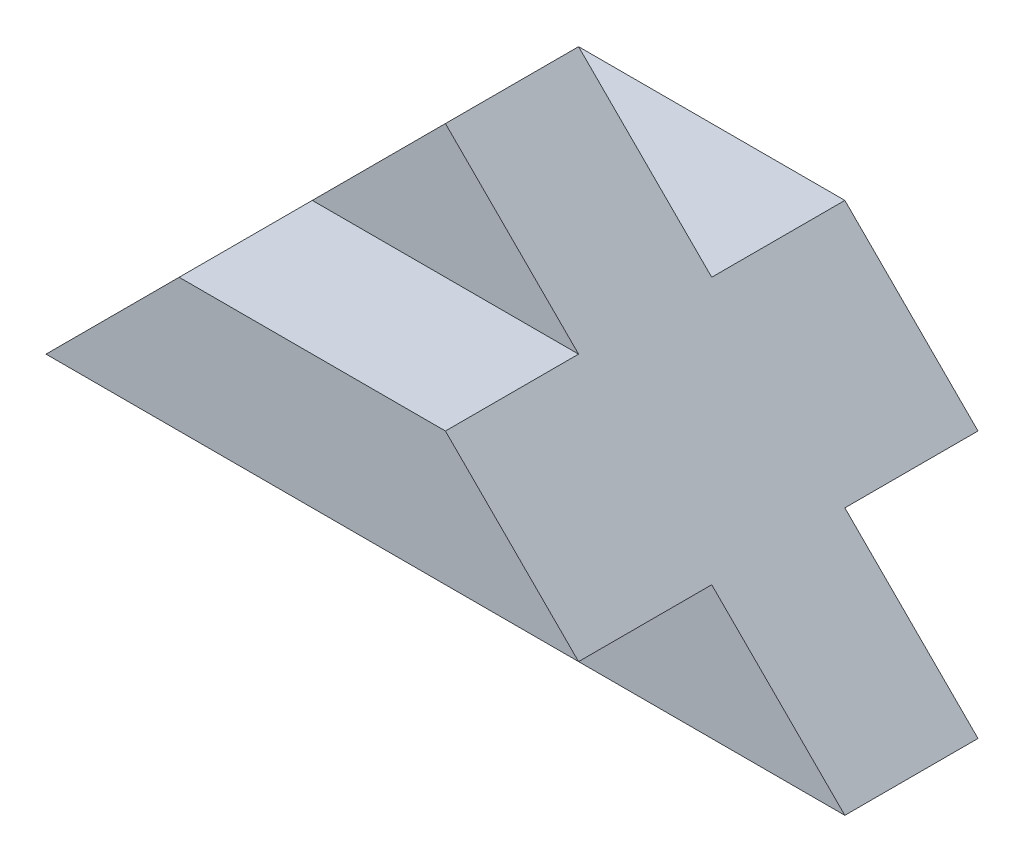
from build123d import *

# Parameters (mm, degrees)
SKETCH1_W           = 50.8
SKETCH1_H           = 152.4
SKETCH1_W_2         = 152.4
SKETCH1_H_2         = 50.8
EXTRUDE_THIN1_DEPTH = 304.8
CHAMFER1_SIZE       = 152.4


with BuildPart() as part:
    # Sketch1 → Extrude-Thin1 (new body)
    with BuildSketch(Plane(origin=(0, 0, 0), x_dir=(0, 0, -1), z_dir=(1, 0, 0))):
        with Locations((0, 76.2)):
            Rectangle(SKETCH1_W, SKETCH1_H)
        with Locations((0, 76.2)):
            Rectangle(SKETCH1_W_2, SKETCH1_H_2)
    extrude(amount=EXTRUDE_THIN1_DEPTH)

    # Chamfer1
    chamfer1_edges = [part.edges().sort_by_distance(p)[0] for p in [
        (304.8, 152.4, 0),
        (0, 152.4, 0),
    ]]
    chamfer(chamfer1_edges, length=CHAMFER1_SIZE - 0.0001)  # a hair under: the kernel refuses the full size


solid = part.part
